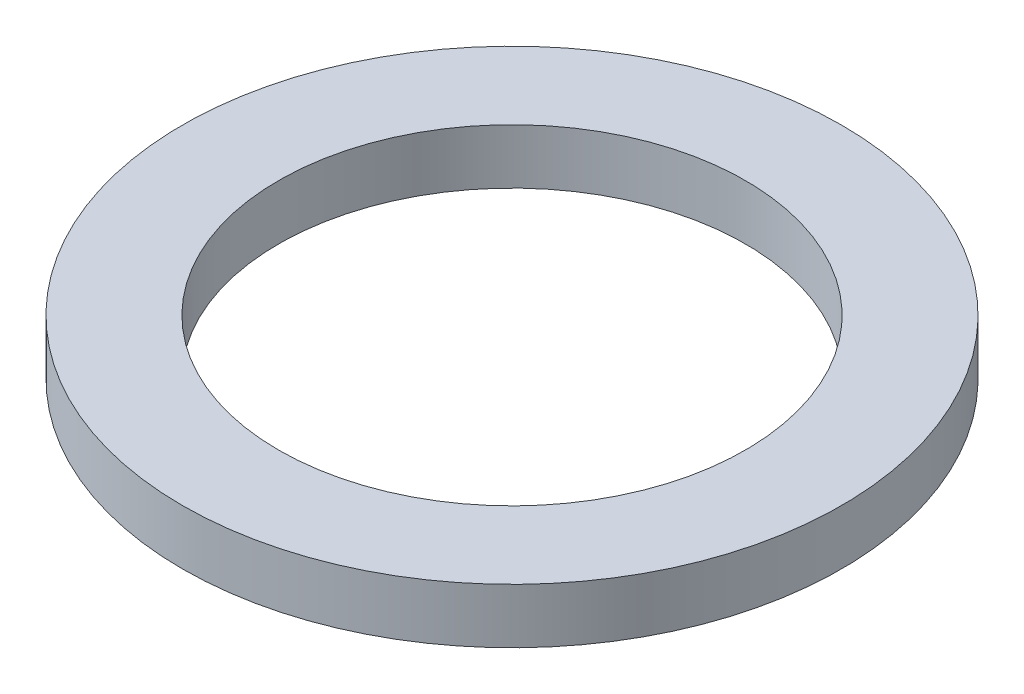
from build123d import *

# Parameters (mm, degrees)
SKETCH1_R           = 60
BOSS_EXTRUDE1_DEPTH = 10
SKETCH2_R           = 42.5
CUT_EXTRUDE1_DEPTH  = 86.440037453


with BuildPart() as part:
    # Sketch1 → Boss-Extrude1 (new body)
    with BuildSketch(Plane(origin=(0, 0, 0), x_dir=(1, 0, 0), z_dir=(0, 1, 0))):
        Circle(SKETCH1_R)
    extrude(amount=BOSS_EXTRUDE1_DEPTH)

    # Sketch2 → Cut-Extrude1 (cut, through all)
    with BuildSketch(Plane(origin=(0, 0, 0), x_dir=(1, 0, 0), z_dir=(0, 1, 0))):
        Circle(SKETCH2_R)
    extrude(amount=CUT_EXTRUDE1_DEPTH, mode=Mode.SUBTRACT)


solid = part.part
